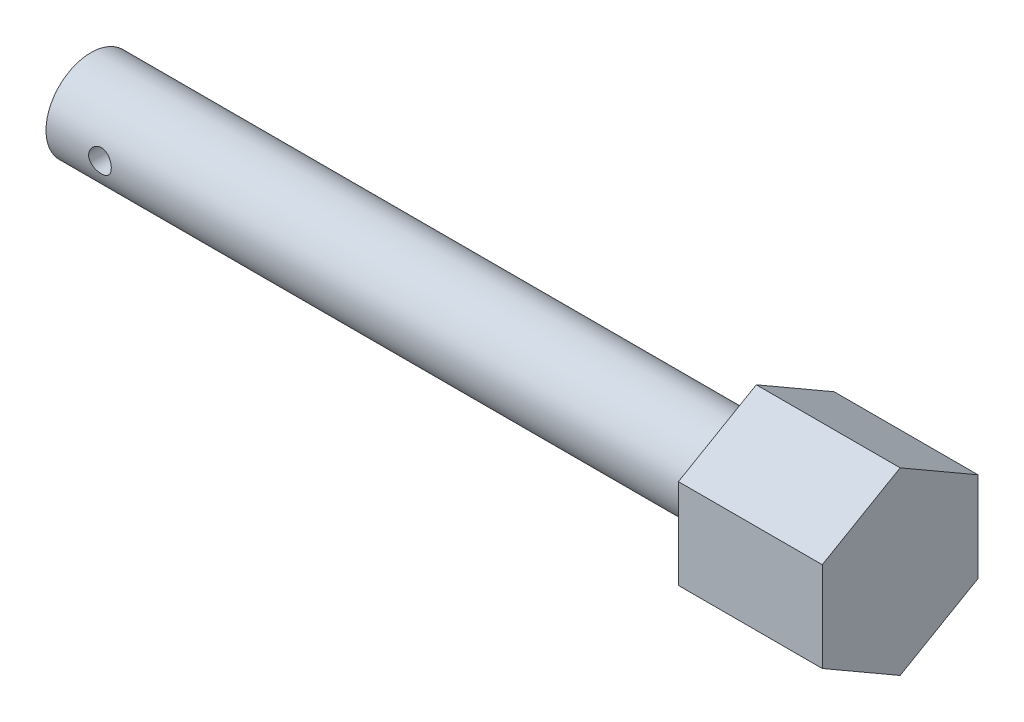
from build123d import *

# Parameters (mm, degrees)
SKETCH1_R           = 3.175
BOSS_EXTRUDE2_DEPTH = 46.99
BOSS_EXTRUDE3_DEPTH = 10.16
SKETCH3_R           = 3.175
SKETCH3_R_2         = 1.778
CUT_EXTRUDE1_DEPTH  = 19.05
SKETCH6_R           = 3.175
BOSS_EXTRUDE5_DEPTH = 49.022
CUT_EXTRUDE5_DEPTH  = 38.1
SKETCH9_R           = 0.866025404
CUT_EXTRUDE7_DEPTH  = 46.99
SKETCH10_R          = 0.8001
CUT_EXTRUDE8_DEPTH  = 5.334


with BuildPart() as part:
    # Sketch1 → Boss-Extrude2 (new body)
    with BuildSketch(Plane(origin=(0, 0, 0), x_dir=(0, 0, -1), z_dir=(1, 0, 0))):
        Circle(SKETCH1_R)
    extrude(amount=BOSS_EXTRUDE2_DEPTH)

    # Sketch2 → Boss-Extrude3 (add)
    with BuildSketch(Plane(origin=(46.99, 0, 0), x_dir=(0, 0, -1), z_dir=(1, 0, 0))):
        Polygon((-5.499261314, 3.175), (-5.499261314, -3.175), (0, -6.35), (5.499261314, -3.175), (5.499261314, 3.175), (0, 6.35), align=None)
    extrude(amount=BOSS_EXTRUDE3_DEPTH)

    # Sketch3 → Cut-Extrude1 (cut)
    with BuildSketch(Plane.ZY):
        Circle(SKETCH3_R)
        Circle(SKETCH3_R_2, mode=Mode.SUBTRACT)
    extrude(amount=-CUT_EXTRUDE1_DEPTH, mode=Mode.SUBTRACT)

    # Sketch6 → Boss-Extrude5 (add)
    with BuildSketch(Plane.ZY):
        Circle(SKETCH6_R)
    extrude(amount=-BOSS_EXTRUDE5_DEPTH)

    # Sketch7 → Cut-Extrude5 (cut)
    with BuildSketch(Plane.ZY):
        Polygon((-0.489261374, 0.714579112), (-0.863474351, -0.066423223), (-0.374212977, -0.781002335), (0.489261374, -0.714579112), (0.863474351, 0.066423223), (0.374212977, 0.781002335), align=None)
    extrude(amount=-CUT_EXTRUDE5_DEPTH, mode=Mode.SUBTRACT)

    # Sketch9 → Cut-Extrude7 (cut)
    with BuildSketch(Plane.ZY):
        Circle(SKETCH9_R)
    extrude(amount=-CUT_EXTRUDE7_DEPTH, mode=Mode.SUBTRACT)

    # Sketch10 → Cut-Extrude8 (cut)
    with BuildSketch(Plane.XY.offset(5.499261314)):
        with Locations((3.81, 0)):
            Circle(SKETCH10_R)
    extrude(amount=-CUT_EXTRUDE8_DEPTH, mode=Mode.SUBTRACT)


solid = part.part
